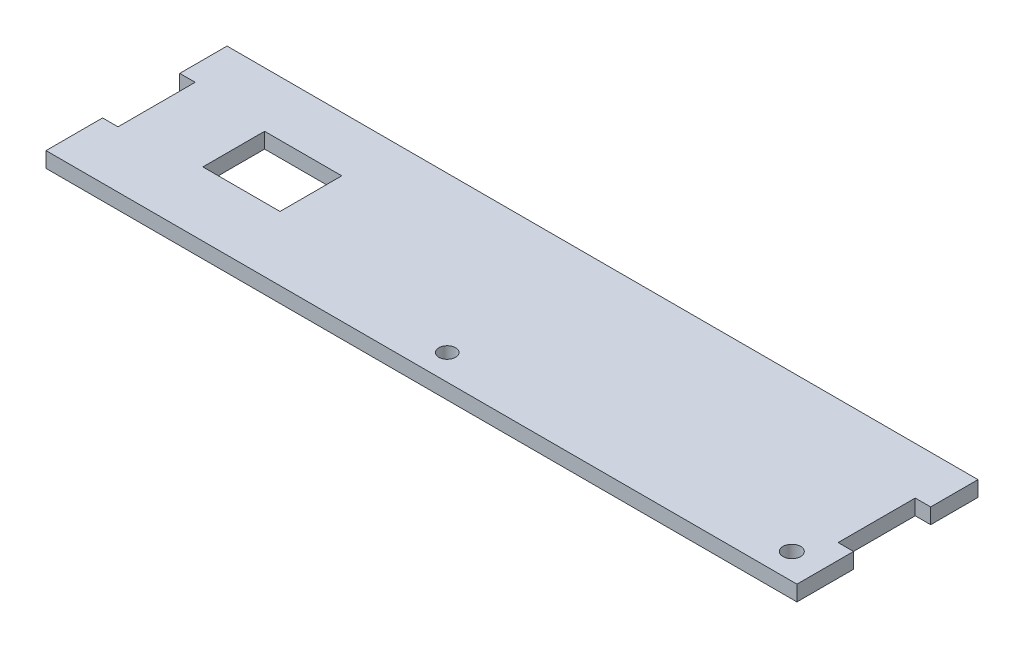
from build123d import *

# Parameters (mm, degrees)
SKETCH1_W           = 146
SKETCH1_H           = 61
BOSS_EXTRUDE1_DEPTH = 3
SKETCH2_R           = 1.621357424
SKETCH2_R_2         = 1.718635432
SKETCH2_W           = 3
SKETCH2_H           = 15
SKETCH2_W_2         = 15
SKETCH2_H_2         = 12
SKETCH2_W_3         = 30
SKETCH2_H_3         = 3
CUT_EXTRUDE1_DEPTH  = 10
SKETCH3_W           = 146
SKETCH3_H           = 25.8
CUT_EXTRUDE2_DEPTH  = 10


with BuildPart() as part:
    # Sketch1 → Boss-Extrude1 (new body)
    with BuildSketch(Plane(origin=(0, 0, 0), x_dir=(1, 0, 0), z_dir=(0, 1, 0))):
        Rectangle(SKETCH1_W, SKETCH1_H)
    extrude(amount=BOSS_EXTRUDE1_DEPTH)

    # Sketch2 → Cut-Extrude1 (cut)
    with BuildSketch(Plane(origin=(0, 3, 0), x_dir=(1, 0, 0), z_dir=(0, 1, 0))):
        with Locations((0, -25.5)):
            Circle(SKETCH2_R)
        with Locations((67, -25.5)):
            Circle(SKETCH2_R_2)
        with Locations((-71.5, -12)):
            Rectangle(SKETCH2_W, SKETCH2_H)
        with Locations((71.5, 13)):
            Rectangle(SKETCH2_W, SKETCH2_H)
        with Locations((71.5, -12)):
            Rectangle(SKETCH2_W, SKETCH2_H)
        with Locations((-71.5, 13)):
            Rectangle(SKETCH2_W, SKETCH2_H)
        with Locations((-47.5, -12)):
            Rectangle(SKETCH2_W_2, SKETCH2_H_2)
        with Locations((-28, 29)):
            Rectangle(SKETCH2_W_3, SKETCH2_H_3)
        with Locations((28, 29)):
            Rectangle(SKETCH2_W_3, SKETCH2_H_3)
    extrude(amount=-CUT_EXTRUDE1_DEPTH, mode=Mode.SUBTRACT)

    # Sketch3 → Cut-Extrude2 (cut)
    with BuildSketch(Plane(origin=(0, 3, 0), x_dir=(1, 0, 0), z_dir=(0, 1, 0))):
        with Locations((0, 17.6)):
            Rectangle(SKETCH3_W, SKETCH3_H)
    extrude(amount=-CUT_EXTRUDE2_DEPTH, mode=Mode.SUBTRACT)


solid = part.part
